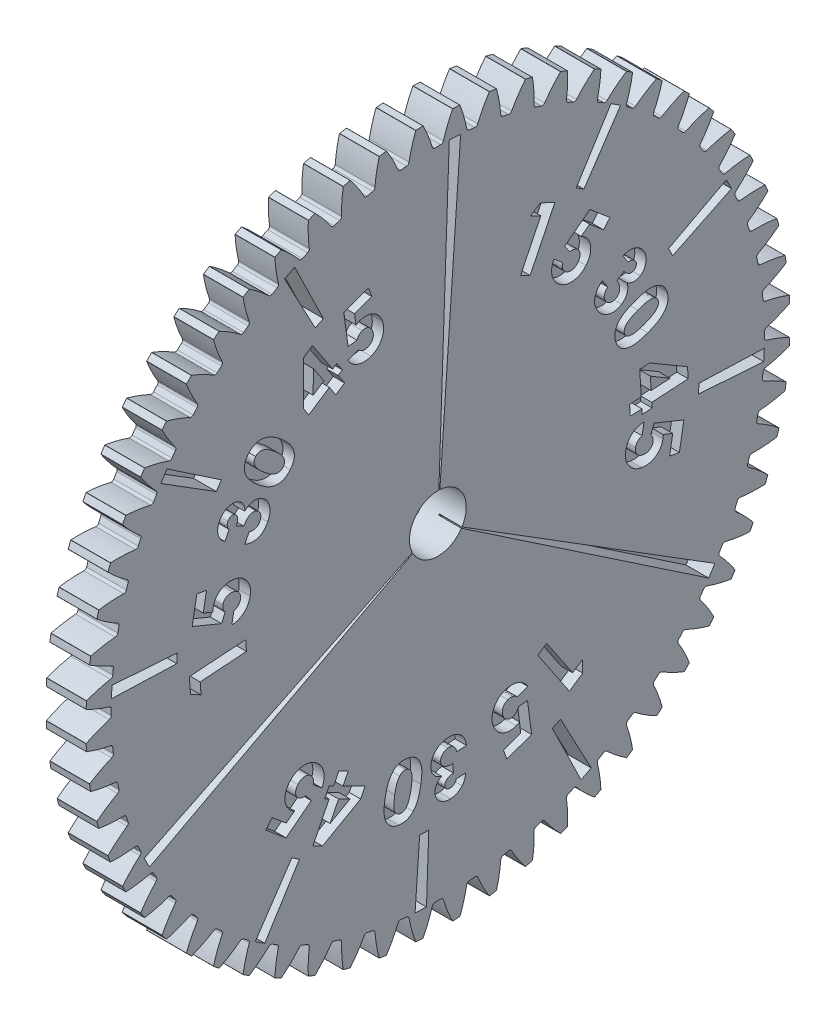
from build123d import *

# Parameters (mm, degrees)
BASPROSKE_W                = 4.445
BASPROSKE_H                = 39.37
TOOTHCUT_DEPTH             = 56.854738608
BREAKS_R                   = 0.0254
ROOTFILLETS_R              = 0.3048
TEETHCUTS_COUNT            = 60
TEETHCUTS_ANGLE            = 354
BREAKS_OF_TEETHCUTS_R      = 0.0254
ROOTFILLETS_OF_TEETHCUTS_R = 0.3048
BORSKE_R                   = 3.175
BORE_DEPTH                 = 50.8000508
TEXT_2_DEPTH               = 1.27
CIRPATTERN1_COUNT          = 3
CUT_EXTRUDE2_START         = -2.54
CUT_EXTRUDE2_DEPTH         = 2.54
CIRPATTERN2_COUNT          = 3


with BuildPart() as part:
    # BasProSke → Base-Revolve (revolve)
    with BuildSketch(Plane(origin=(0, 0, 0), x_dir=(1, 0, 0), z_dir=(0, 1, 0)), mode=Mode.PRIVATE) as base_revolve_sk:
        with Locations((2.2225, 19.685)):
            Rectangle(BASPROSKE_W, BASPROSKE_H)
    revolve(base_revolve_sk.sketch.rotate(Axis((-10, 0, 0), (1, 0, 0)), 180), axis=Axis((-10, 0, 0), (1, 0, 0)))

    # TooCutSke → ToothCut (cut, through all)
    with BuildSketch(Plane(origin=(0, 0, 0), x_dir=(0, 0, -1), z_dir=(1, 0, 0))):
        with BuildLine():
            ThreePointArc((0.554451235, 36.520991483), (0, 36.5252), (-0.554451235, 36.520991483))
            ThreePointArc((-0.554451235, 36.520991483), (-1.040157024, 37.968457667), (-1.668254373, 39.360061846))
            ThreePointArc((-1.668254373, 39.360061846), (0, 39.3954), (1.668254373, 39.360061846))
            ThreePointArc((1.668254373, 39.360061846), (1.040157024, 37.968457667), (0.554451235, 36.520991483))
        make_face()
    toothcut = extrude(amount=TOOTHCUT_DEPTH, mode=Mode.SUBTRACT)

    # Breaks
    breaks_edges = [part.edges().sort_by_distance(p)[0] for p in [
        (2.2225, 39.335177282, -1.655514489),
        (2.2225, 39.335177282, 1.655514489),
    ]]
    fillet(breaks_edges, radius=BREAKS_R)

    # RootFillets
    rootfillets_edges = [part.edges().sort_by_distance(p)[0] for p in [
        (2.2225, 36.520991483, -0.554451235),
        (2.2225, 36.520991483, 0.554451235),
    ]]
    fillet(rootfillets_edges, radius=ROOTFILLETS_R)

    # TeethCuts: ToothCut ×60 about axis
    teethcuts_axis = Axis((-10, 0, 0), (1, 0, 0))
    for i in range(1, TEETHCUTS_COUNT):
        add(toothcut.rotate(teethcuts_axis, i * TEETHCUTS_ANGLE / (TEETHCUTS_COUNT - 1)), mode=Mode.SUBTRACT)

    # Breaks of TeethCuts
    breaks_of_teethcuts_edges = [part.edges().sort_by_distance(p)[0] for p in [
        (2.2225, 39.29274345, 2.465200226),
        (2.2225, 38.946646679, 5.758091041),
        (2.2225, 38.819810099, 6.558905692),
        (2.2225, 38.131408466, 9.797580742),
        (2.2225, 37.921558785, 10.580750414),
        (2.2225, 36.898394562, 13.729726099),
        (2.2225, 36.607830937, 14.486670221),
        (2.2225, 35.261114125, 17.511445704),
        (2.2225, 34.893020033, 18.233871037),
        (2.2225, 33.237505544, 21.101306244),
        (2.2225, 32.795913899, 21.781297747),
        (2.2225, 30.849739896, 24.459976458),
        (2.2225, 30.33948887, 25.090084),
        (2.2225, 28.123978042, 27.550658052),
        (2.2225, 27.550658052, 28.123978042),
        (2.2225, 25.090084, 30.33948887),
        (2.2225, 24.459976458, 30.849739896),
        (2.2225, 21.781297747, 32.795913899),
        (2.2225, 21.101306244, 33.237505544),
        (2.2225, 18.233871037, 34.893020033),
        (2.2225, 17.511445704, 35.261114125),
        (2.2225, 14.486670221, 36.607830937),
        (2.2225, 13.729726099, 36.898394562),
        (2.2225, 10.580750414, 37.921558785),
        (2.2225, 9.797580742, 38.131408466),
        (2.2225, 6.558905692, 38.819810099),
        (2.2225, 5.758091041, 38.946646679),
        (2.2225, 2.465200226, 39.29274345),
        (2.2225, 1.655514489, 39.335177282),
        (2.2225, -1.655514489, 39.335177282),
        (2.2225, -2.465200226, 39.29274345),
        (2.2225, -5.758091041, 38.946646679),
        (2.2225, -6.558905692, 38.819810099),
        (2.2225, -9.797580742, 38.131408466),
        (2.2225, -10.580750414, 37.921558785),
        (2.2225, -13.729726099, 36.898394562),
        (2.2225, -14.486670221, 36.607830937),
        (2.2225, -17.511445704, 35.261114125),
        (2.2225, -18.233871037, 34.893020033),
        (2.2225, -21.101306244, 33.237505544),
        (2.2225, -21.781297747, 32.795913899),
        (2.2225, -24.459976458, 30.849739896),
        (2.2225, -25.090084, 30.33948887),
        (2.2225, -27.550658052, 28.123978042),
        (2.2225, -28.123978042, 27.550658052),
        (2.2225, -30.33948887, 25.090084),
        (2.2225, -30.849739896, 24.459976458),
        (2.2225, -32.795913899, 21.781297747),
        (2.2225, -33.237505544, 21.101306244),
        (2.2225, -34.893020033, 18.233871037),
        (2.2225, -35.261114125, 17.511445704),
        (2.2225, -36.607830937, 14.486670221),
        (2.2225, -36.898394562, 13.729726099),
        (2.2225, -37.921558785, 10.580750414),
        (2.2225, -38.131408466, 9.797580742),
        (2.2225, -38.819810099, 6.558905692),
        (2.2225, -38.946646679, 5.758091041),
        (2.2225, -39.29274345, 2.465200226),
        (2.2225, -39.335177282, 1.655514489),
        (2.2225, -39.335177282, -1.655514489),
        (2.2225, -39.29274345, -2.465200226),
        (2.2225, -38.946646679, -5.758091041),
        (2.2225, -38.819810099, -6.558905692),
        (2.2225, -38.131408466, -9.797580742),
        (2.2225, -37.921558785, -10.580750414),
        (2.2225, -36.898394562, -13.729726099),
        (2.2225, -36.607830937, -14.486670221),
        (2.2225, -35.261114125, -17.511445704),
        (2.2225, -34.893020033, -18.233871037),
        (2.2225, -33.237505544, -21.101306244),
        (2.2225, -32.795913899, -21.781297747),
        (2.2225, -30.849739896, -24.459976458),
        (2.2225, -30.33948887, -25.090084),
        (2.2225, -28.123978042, -27.550658052),
        (2.2225, -27.550658052, -28.123978042),
        (2.2225, -25.090084, -30.33948887),
        (2.2225, -24.459976458, -30.849739896),
        (2.2225, -21.781297747, -32.795913899),
        (2.2225, -21.101306244, -33.237505544),
        (2.2225, -18.233871037, -34.893020033),
        (2.2225, -17.511445704, -35.261114125),
        (2.2225, -14.486670221, -36.607830937),
        (2.2225, -13.729726099, -36.898394562),
        (2.2225, -10.580750414, -37.921558785),
        (2.2225, -9.797580742, -38.131408466),
        (2.2225, -6.558905692, -38.819810099),
        (2.2225, -5.758091041, -38.946646679),
        (2.2225, -2.465200226, -39.29274345),
        (2.2225, -1.655514489, -39.335177282),
        (2.2225, 1.655514489, -39.335177282),
        (2.2225, 2.465200226, -39.29274345),
        (2.2225, 5.758091041, -38.946646679),
        (2.2225, 6.558905692, -38.819810099),
        (2.2225, 9.797580742, -38.131408466),
        (2.2225, 10.580750414, -37.921558785),
        (2.2225, 13.729726099, -36.898394562),
        (2.2225, 14.486670221, -36.607830937),
        (2.2225, 17.511445704, -35.261114125),
        (2.2225, 18.233871037, -34.893020033),
        (2.2225, 21.101306244, -33.237505544),
        (2.2225, 21.781297747, -32.795913899),
        (2.2225, 24.459976458, -30.849739896),
        (2.2225, 25.090084, -30.33948887),
        (2.2225, 27.550658052, -28.123978042),
        (2.2225, 28.123978042, -27.550658052),
        (2.2225, 30.33948887, -25.090084),
        (2.2225, 30.849739896, -24.459976458),
        (2.2225, 32.795913899, -21.781297747),
        (2.2225, 33.237505544, -21.101306244),
        (2.2225, 34.893020033, -18.233871037),
        (2.2225, 35.261114125, -17.511445704),
        (2.2225, 36.607830937, -14.486670221),
        (2.2225, 36.898394562, -13.729726099),
        (2.2225, 37.921558785, -10.580750414),
        (2.2225, 38.131408466, -9.797580742),
        (2.2225, 38.819810099, -6.558905692),
        (2.2225, 38.946646679, -5.758091041),
        (2.2225, 39.29274345, -2.465200226),
    ]]
    fillet(breaks_of_teethcuts_edges, radius=BREAKS_OF_TEETHCUTS_R)

    # RootFillets of TeethCuts
    rootfillets_of_teethcuts_edges = [part.edges().sort_by_distance(p)[0] for p in [
        (2.2225, 36.378881605, 3.266069224),
        (2.2225, 36.262969734, 4.36889701),
        (2.2225, 35.838197089, 7.050805945),
        (2.2225, 35.607643301, 8.135476234),
        (2.2225, 34.904861785, 10.75829256),
        (2.2225, 34.562192077, 11.812921479),
        (2.2225, 33.589101511, 14.34790907),
        (2.2225, 33.138070244, 15.360941884),
        (2.2225, 31.905332013, 17.780326887),
        (2.2225, 31.350880778, 18.740664596),
        (2.2225, 29.87200102, 21.017939721),
        (2.2225, 29.220204502, 21.915060664),
        (2.2225, 27.511386132, 24.025275609),
        (2.2225, 26.769385551, 24.849350742),
        (2.2225, 24.849350742, 26.769385551),
        (2.2225, 24.025275609, 27.511386132),
        (2.2225, 21.915060664, 29.220204502),
        (2.2225, 21.017939721, 29.87200102),
        (2.2225, 18.740664596, 31.350880778),
        (2.2225, 17.780326887, 31.905332013),
        (2.2225, 15.360941884, 33.138070244),
        (2.2225, 14.34790907, 33.589101511),
        (2.2225, 11.812921479, 34.562192077),
        (2.2225, 10.75829256, 34.904861785),
        (2.2225, 8.135476234, 35.607643301),
        (2.2225, 7.050805945, 35.838197089),
        (2.2225, 4.36889701, 36.262969734),
        (2.2225, 3.266069224, 36.378881605),
        (2.2225, 0.554451235, 36.520991483),
        (2.2225, -0.554451235, 36.520991483),
        (2.2225, -3.266069224, 36.378881605),
        (2.2225, -4.36889701, 36.262969734),
        (2.2225, -7.050805945, 35.838197089),
        (2.2225, -8.135476234, 35.607643301),
        (2.2225, -10.75829256, 34.904861785),
        (2.2225, -11.812921479, 34.562192077),
        (2.2225, -14.34790907, 33.589101511),
        (2.2225, -15.360941884, 33.138070244),
        (2.2225, -17.780326887, 31.905332013),
        (2.2225, -18.740664596, 31.350880778),
        (2.2225, -21.017939721, 29.87200102),
        (2.2225, -21.915060664, 29.220204502),
        (2.2225, -24.025275609, 27.511386132),
        (2.2225, -24.849350742, 26.769385551),
        (2.2225, -26.769385551, 24.849350742),
        (2.2225, -27.511386132, 24.025275609),
        (2.2225, -29.220204502, 21.915060664),
        (2.2225, -29.87200102, 21.017939721),
        (2.2225, -31.350880778, 18.740664596),
        (2.2225, -31.905332013, 17.780326887),
        (2.2225, -33.138070244, 15.360941884),
        (2.2225, -33.589101511, 14.34790907),
        (2.2225, -34.562192077, 11.812921479),
        (2.2225, -34.904861785, 10.75829256),
        (2.2225, -35.607643301, 8.135476234),
        (2.2225, -35.838197089, 7.050805945),
        (2.2225, -36.262969734, 4.36889701),
        (2.2225, -36.378881605, 3.266069224),
        (2.2225, -36.520991483, 0.554451235),
        (2.2225, -36.520991483, -0.554451235),
        (2.2225, -36.378881605, -3.266069224),
        (2.2225, -36.262969734, -4.36889701),
        (2.2225, -35.838197089, -7.050805945),
        (2.2225, -35.607643301, -8.135476234),
        (2.2225, -34.904861785, -10.75829256),
        (2.2225, -34.562192077, -11.812921479),
        (2.2225, -33.589101511, -14.34790907),
        (2.2225, -33.138070244, -15.360941884),
        (2.2225, -31.905332013, -17.780326887),
        (2.2225, -31.350880778, -18.740664596),
        (2.2225, -29.87200102, -21.017939721),
        (2.2225, -29.220204502, -21.915060664),
        (2.2225, -27.511386132, -24.025275609),
        (2.2225, -26.769385551, -24.849350742),
        (2.2225, -24.849350742, -26.769385551),
        (2.2225, -24.025275609, -27.511386132),
        (2.2225, -21.915060664, -29.220204502),
        (2.2225, -21.017939721, -29.87200102),
        (2.2225, -18.740664596, -31.350880778),
        (2.2225, -17.780326887, -31.905332013),
        (2.2225, -15.360941884, -33.138070244),
        (2.2225, -14.34790907, -33.589101511),
        (2.2225, -11.812921479, -34.562192077),
        (2.2225, -10.75829256, -34.904861785),
        (2.2225, -8.135476234, -35.607643301),
        (2.2225, -7.050805945, -35.838197089),
        (2.2225, -4.36889701, -36.262969734),
        (2.2225, -3.266069224, -36.378881605),
        (2.2225, -0.554451235, -36.520991483),
        (2.2225, 0.554451235, -36.520991483),
        (2.2225, 3.266069224, -36.378881605),
        (2.2225, 4.36889701, -36.262969734),
        (2.2225, 7.050805945, -35.838197089),
        (2.2225, 8.135476234, -35.607643301),
        (2.2225, 10.75829256, -34.904861785),
        (2.2225, 11.812921479, -34.562192077),
        (2.2225, 14.34790907, -33.589101511),
        (2.2225, 15.360941884, -33.138070244),
        (2.2225, 17.780326887, -31.905332013),
        (2.2225, 18.740664596, -31.350880778),
        (2.2225, 21.017939721, -29.87200102),
        (2.2225, 21.915060664, -29.220204502),
        (2.2225, 24.025275609, -27.511386132),
        (2.2225, 24.849350742, -26.769385551),
        (2.2225, 26.769385551, -24.849350742),
        (2.2225, 27.511386132, -24.025275609),
        (2.2225, 29.220204502, -21.915060664),
        (2.2225, 29.87200102, -21.017939721),
        (2.2225, 31.350880778, -18.740664596),
        (2.2225, 31.905332013, -17.780326887),
        (2.2225, 33.138070244, -15.360941884),
        (2.2225, 33.589101511, -14.34790907),
        (2.2225, 34.562192077, -11.812921479),
        (2.2225, 34.904861785, -10.75829256),
        (2.2225, 35.607643301, -8.135476234),
        (2.2225, 35.838197089, -7.050805945),
        (2.2225, 36.262969734, -4.36889701),
        (2.2225, 36.378881605, -3.266069224),
    ]]
    fillet(rootfillets_of_teethcuts_edges, radius=ROOTFILLETS_OF_TEETHCUTS_R)

    # BorSke → Bore (cut, symmetric)
    with BuildSketch(Plane(origin=(0, 0, 0), x_dir=(0, 0, -1), z_dir=(1, 0, 0))):
        with Locations(Location((0, 0, 0), (0, 0, 180))):
            Circle(BORSKE_R)
    extrude(amount=BORE_DEPTH, both=True, mode=Mode.SUBTRACT)

    # Sketch2 → Text 2 (cut)
    # profile 1 of 6: a face of its own
    with BuildSketch(Plane(origin=(4.445, 0, 0), x_dir=(0, 0, -1), z_dir=(1, 0, 0))):
        Polygon((11.463172713, 25.32202846), (13.078657489, 24.533366601), (10.311980806, 18.861361392), (9.239655085, 19.384167883), (11.511510053, 24.042360992), (10.342509652, 24.612232787), align=None)
    # profile 2 of 6: a face of its own
    with BuildSketch(Plane(origin=(4.445, 0, 0), x_dir=(0, 0, -1), z_dir=(1, 0, 0))):
        with BuildLine():
            Line((16.994326089, 21.914349586), (19.240740352, 20.015200949))
            Line((19.240740352, 20.015200949), (18.529672644, 19.174385644))
            Line((18.529672644, 19.174385644), (16.965069278, 20.497302311))
            Line((16.965069278, 20.497302311), (16.032667435, 19.790050708))
            add(Edge.make_bspline(
                [(16.032667435, 19.790050708), (16.065177053, 19.774465623), (16.129248149, 19.74374999), (16.218778465, 19.689429426), (16.30359355, 19.634524209), (16.354827519, 19.592919644), (16.37993306, 19.572532679)],
                knots=[0, 0, 0, 0, 1.052260992, 2.073832889, 3.056144392, 4, 4, 4, 4], degree=3))
            add(Edge.make_bspline(
                [(16.37993306, 19.572532679), (16.432235421, 19.526497291), (16.535062113, 19.435991498), (16.669812959, 19.28473163), (16.786754444, 19.12600808), (16.88522394, 18.959077153), (16.964198474, 18.783547688), (17.026104995, 18.600546318), (17.067799944, 18.408978186), (17.090393993, 18.211235314), (17.09406545, 18.011924263), (17.079637904, 17.813943399), (17.041752339, 17.62022398), (16.985569033, 17.429253458), (16.90931451, 17.241880925), (16.810764607, 17.059429154), (16.695758348, 16.87834814), (16.603746949, 16.765535764), (16.556745961, 16.707909282)],
                knots=[0, 0, 0, 0, 1.039746453, 2.044146476, 3.018084295, 3.980279885, 4.932484949, 5.887633077, 6.860170139, 7.854539952, 8.855200445, 9.833308004, 10.813156242, 11.796925032, 12.802302632, 13.82774001, 14.890372628, 16, 16, 16, 16], degree=3))
            add(Edge.make_bspline(
                [(16.556745961, 16.707909282), (16.506866878, 16.651822104), (16.408684147, 16.541419266), (16.24630516, 16.394793604), (16.07489003, 16.268069585), (15.894450777, 16.160160596), (15.704132457, 16.072435685), (15.504908242, 16.003030866), (15.296258324, 15.955146138), (15.081662412, 15.92604685), (14.865299383, 15.917144186), (14.652725442, 15.928334866), (14.445788148, 15.959902088), (14.246216717, 16.014017164), (14.051797242, 16.086601448), (13.865192471, 16.181990136), (13.682378987, 16.294677092), (13.569923045, 16.385642879), (13.512765592, 16.431877631)],
                knots=[0, 0, 0, 0, 1.057096413, 2.080804361, 3.076275545, 4.056932344, 5.038044106, 6.024418116, 7.024469329, 8.049484239, 9.072075593, 10.071358971, 11.044872464, 12.01594416, 12.980319939, 13.963667059, 14.965002631, 16, 16, 16, 16], degree=3))
            add(Edge.make_bspline(
                [(13.512765592, 16.431877631), (13.463260104, 16.47518531), (13.365872666, 16.560380385), (13.234683087, 16.699867502), (13.118278656, 16.845483377), (13.016226635, 16.997389755), (12.92736784, 17.155574585), (12.855641819, 17.321394665), (12.796156727, 17.492496057), (12.753442018, 17.669338735), (12.725108253, 17.849289123), (12.714089512, 18.030246789), (12.717491971, 18.211154573), (12.738121827, 18.392087515), (12.775165256, 18.573425379), (12.829195436, 18.753953183), (12.897838444, 18.935027926), (12.955484177, 19.052281898), (12.984870961, 19.112055916)],
                knots=[0, 0, 0, 0, 1.062988183, 2.091115503, 3.091132471, 4.074179486, 5.047037717, 6.020185775, 6.991472597, 7.972509485, 8.957634093, 9.933097682, 10.899970974, 11.879641497, 12.873245918, 13.888446092, 14.923566859, 16, 16, 16, 16], degree=3))
            Line((12.984870961, 19.112055916), (13.942713509, 18.303041493))
            add(Edge.make_bspline(
                [(13.942713509, 18.303041493), (13.931522883, 18.251098307), (13.909671616, 18.149671953), (13.901769817, 17.997700988), (13.910549842, 17.851936564), (13.942986937, 17.713932066), (13.994212693, 17.584809359), (14.06235303, 17.465435749), (14.146657333, 17.355588807), (14.214786815, 17.292951611), (14.249274006, 17.261244618)],
                knots=[0, 0, 0, 0, 1.109714882, 2.166873866, 3.171506689, 4.154615387, 5.118006578, 6.067293887, 7.021662827, 8, 8, 8, 8], degree=3))
            add(Edge.make_bspline(
                [(14.249274006, 17.261244618), (14.274712656, 17.240725314), (14.324628007, 17.200462631), (14.405757747, 17.150990006), (14.488687404, 17.109854915), (14.574749032, 17.077759699), (14.663770244, 17.054578235), (14.756012122, 17.04221278), (14.850962671, 17.038505631), (14.948152218, 17.043263444), (15.045244296, 17.058645676), (15.139853282, 17.08278564), (15.231189557, 17.116139704), (15.319234018, 17.159340315), (15.402803499, 17.213404705), (15.48402812, 17.274999357), (15.56201889, 17.346134315), (15.609174048, 17.400252207), (15.633248365, 17.427881237)],
                knots=[0, 0, 0, 0, 1.006070259, 1.974096513, 2.92063712, 3.854926314, 4.799210134, 5.748901234, 6.716486575, 7.723828463, 8.741956986, 9.740106985, 10.727943464, 11.732910342, 12.754971009, 13.789728568, 14.871581032, 16, 16, 16, 16], degree=3))
            add(Edge.make_bspline(
                [(15.633248365, 17.427881237), (15.676065915, 17.482881899), (15.758928065, 17.58932127), (15.845389763, 17.767849421), (15.894252458, 17.952410848), (15.901550287, 18.109002882), (15.891985005, 18.231995008), (15.875419451, 18.320749026), (15.849541044, 18.404909091), (15.81701918, 18.484915971), (15.775611006, 18.560079073), (15.72538683, 18.629808183), (15.668550898, 18.696986394), (15.624027955, 18.73606616), (15.601447483, 18.755886045)],
                knots=[0, 0, 0, 0, 1.689306487, 3.269210124, 4.780487642, 6.296670098, 7.051026907, 7.774155296, 8.484407965, 9.186323429, 9.868544708, 10.562939839, 11.271173573, 12, 12, 12, 12], degree=3))
            add(Edge.make_bspline(
                [(15.601447483, 18.755886045), (15.57564506, 18.776103421), (15.524098725, 18.816492329), (15.43688596, 18.864917593), (15.343299524, 18.904704474), (15.241259579, 18.93200858), (15.133192321, 18.951480527), (15.017751887, 18.959426289), (14.895167636, 18.960452823), (14.811464995, 18.951376041), (14.76826439, 18.946691333)],
                knots=[0, 0, 0, 0, 0.893213257, 1.784401, 2.712669867, 3.66147751, 4.660120291, 5.704561958, 6.81527856, 8, 8, 8, 8], degree=3))
            Line((14.76826439, 18.946691333), (14.164047644, 19.741713368))
            Line((14.164047644, 19.741713368), (16.994326089, 21.914349586))
        make_face()
    # profile 3 of 6: a face of its own
    with BuildSketch(Plane(origin=(4.445, 0, 0), x_dir=(0, 0, -1), z_dir=(1, 0, 0))):
        with BuildLine():
            Line((21.277803729, 14.66424021), (20.698285666, 15.545760643))
            add(Edge.make_bspline(
                [(20.698285666, 15.545760643), (20.746206209, 15.567785489), (20.840063472, 15.610923392), (20.983091161, 15.663526881), (21.124499675, 15.704572279), (21.264723573, 15.734330713), (21.403712722, 15.750452818), (21.540943192, 15.755067628), (21.676572145, 15.749154856), (21.765314698, 15.734029232), (21.809514466, 15.726495652)],
                knots=[0, 0, 0, 0, 1.104501895, 2.163279423, 3.188882884, 4.186934479, 5.162547534, 6.115750253, 7.061516736, 8, 8, 8, 8], degree=3))
            add(Edge.make_bspline(
                [(21.809514466, 15.726495652), (21.870157612, 15.713545983), (21.989780474, 15.688001851), (22.160881894, 15.625122768), (22.323696947, 15.550220967), (22.476644985, 15.457114769), (22.619373934, 15.346812625), (22.752210611, 15.220014664), (22.877636075, 15.078468662), (22.950185238, 14.973279408), (22.987207107, 14.919601288)],
                knots=[0, 0, 0, 0, 1.012219785, 1.99667455, 2.97136752, 3.93764159, 4.915929319, 5.913413002, 6.935213775, 8, 8, 8, 8], degree=3))
            add(Edge.make_bspline(
                [(22.987207107, 14.919601288), (23.018020628, 14.870357031), (23.078724473, 14.773343913), (23.153132622, 14.621399078), (23.212116024, 14.46813366), (23.254302553, 14.312964684), (23.281226026, 14.156007707), (23.29318354, 13.997066191), (23.288310494, 13.836099371), (23.267253103, 13.675710754), (23.23218363, 13.519484596), (23.186683146, 13.370342805), (23.124581021, 13.232065859), (23.052982721, 13.101989399), (22.967370137, 12.982105717), (22.867881943, 12.873694391), (22.758744007, 12.771428464), (22.675900018, 12.714397327), (22.633899315, 12.685483366)],
                knots=[0, 0, 0, 0, 1.107732714, 2.182276907, 3.222098425, 4.236731281, 5.244975467, 6.25624231, 7.272635154, 8.312033487, 9.337583208, 10.324994568, 11.281254606, 12.224107316, 13.15427612, 14.083616847, 15.028421484, 16, 16, 16, 16], degree=3))
            add(Edge.make_bspline(
                [(22.633899315, 12.685483366), (22.580001733, 12.652975741), (22.473334621, 12.588640861), (22.298181922, 12.524201071), (22.117049474, 12.483607491), (21.929491339, 12.470828407), (21.738381444, 12.486798373), (21.545567193, 12.52897812), (21.352568195, 12.600799328), (21.229983152, 12.668306251), (21.167030658, 12.70297385)],
                knots=[0, 0, 0, 0, 0.97285042, 1.925339533, 2.874628017, 3.839982423, 4.824236715, 5.8348984, 6.888130714, 8, 8, 8, 8], degree=3))
            add(Edge.make_bspline(
                [(21.167030658, 12.70297385), (21.178868137, 12.659581605), (21.202163808, 12.574187452), (21.226865944, 12.445640798), (21.240642801, 12.319295545), (21.245827454, 12.194959598), (21.239949732, 12.072048262), (21.223470785, 11.951216877), (21.197812751, 11.832155443), (21.161594791, 11.716004745), (21.11624184, 11.603384468), (21.062772695, 11.495296263), (20.99897788, 11.393700131), (20.927785348, 11.296205558), (20.847197566, 11.204364657), (20.758220043, 11.117458225), (20.659836244, 11.036948129), (20.58940975, 10.98804937), (20.553697659, 10.963253631)],
                knots=[0, 0, 0, 0, 1.085783287, 2.136776832, 3.156593573, 4.152110908, 5.138651828, 6.123494972, 7.093605523, 8.076165464, 9.057334978, 10.02266719, 10.983655672, 11.950355534, 12.934751409, 13.930268743, 14.95047406, 16, 16, 16, 16], degree=3))
            add(Edge.make_bspline(
                [(20.553697659, 10.963253631), (20.499524982, 10.929850016), (20.392766115, 10.864021036), (20.223593056, 10.786176058), (20.051634305, 10.72567719), (19.875474265, 10.686141443), (19.695735615, 10.665077641), (19.512387441, 10.662478665), (19.325412769, 10.681031445), (19.137031579, 10.71638697), (18.951435509, 10.771493135), (18.771796412, 10.841981163), (18.601864669, 10.932894971), (18.44070149, 11.040881423), (18.2865922, 11.164642308), (18.143787211, 11.307993042), (18.007915587, 11.46728946), (17.927904461, 11.584346291), (17.886981747, 11.644216505)],
                knots=[0, 0, 0, 0, 0.992976801, 1.956873524, 2.901178572, 3.834616776, 4.769572912, 5.722478348, 6.691728983, 7.698702438, 8.710765565, 9.71039679, 10.706780293, 11.713351317, 12.736058125, 13.787462115, 14.86836917, 16, 16, 16, 16], degree=3))
            add(Edge.make_bspline(
                [(17.886981747, 11.644216505), (17.850586232, 11.70231984), (17.779384946, 11.815988576), (17.69203118, 11.992993059), (17.621947285, 12.170210024), (17.572097898, 12.34846343), (17.539674372, 12.527668961), (17.527537794, 12.707434776), (17.531261942, 12.888032856), (17.556796092, 13.067568033), (17.597954242, 13.244861467), (17.659089142, 13.416697971), (17.737920268, 13.582169842), (17.834072051, 13.741736557), (17.948825663, 13.894592169), (18.081756511, 14.040638947), (18.231225723, 14.181392803), (18.34138757, 14.267111684), (18.397703902, 14.310932417)],
                knots=[0, 0, 0, 0, 1.083966736, 2.120586185, 3.117346372, 4.094495742, 5.04368067, 5.992945248, 6.940116803, 7.895731843, 8.856141217, 9.814836857, 10.774655634, 11.751069679, 12.756947196, 13.792983004, 14.871740937, 16, 16, 16, 16], degree=3))
            Line((18.397703902, 14.310932417), (18.994712449, 13.402593241))
            add(Edge.make_bspline(
                [(18.994712449, 13.402593241), (18.943011596, 13.353123954), (18.844853637, 13.259202791), (18.728490257, 13.102319072), (18.6479002, 12.942659497), (18.602965052, 12.780353531), (18.595718278, 12.61790818), (18.618052659, 12.456733199), (18.673873993, 12.297347219), (18.732491188, 12.198722419), (18.762672018, 12.147942467)],
                knots=[0, 0, 0, 0, 1.215706275, 2.308109811, 3.304671691, 4.243023354, 5.15010043, 6.051568661, 6.996791386, 8, 8, 8, 8], degree=3))
            add(Edge.make_bspline(
                [(18.762672018, 12.147942467), (18.780544189, 12.122380518), (18.815647885, 12.072172917), (18.874388897, 12.002956761), (18.937186899, 11.940770045), (19.005026468, 11.88709537), (19.077001393, 11.841208086), (19.152899785, 11.802243651), (19.233779931, 11.772455855), (19.344445034, 11.741212774), (19.485625558, 11.723909411), (19.653240552, 11.736084121), (19.815034428, 11.785198424), (19.91257368, 11.84156428), (19.962519273, 11.870426775)],
                knots=[0, 0, 0, 0, 0.816628101, 1.603983289, 2.374303935, 3.127961515, 3.865071511, 4.607226425, 5.357921314, 6.118696777, 7.616353983, 9.056214768, 10.492616077, 12, 12, 12, 12], degree=3))
            add(Edge.make_bspline(
                [(19.962519273, 11.870426775), (19.988629032, 11.888891286), (20.040359014, 11.925474115), (20.109334434, 11.990093881), (20.169379058, 12.061661852), (20.219562707, 12.140215149), (20.260902416, 12.225562517), (20.293323946, 12.317466496), (20.31667333, 12.416355493), (20.330537187, 12.521016639), (20.334107429, 12.631190954), (20.325659833, 12.745238018), (20.305614591, 12.863211103), (20.272491031, 12.983966372), (20.227968921, 13.108465311), (20.170042378, 13.235407693), (20.101350269, 13.366366238), (20.048175432, 13.45265344), (20.020820889, 13.497041859)],
                knots=[0, 0, 0, 0, 0.844575966, 1.673316897, 2.490254722, 3.308225666, 4.130765416, 4.991927547, 5.879113606, 6.812004279, 7.778301382, 8.78777021, 9.829963668, 10.936563892, 12.093531996, 13.32141298, 14.622063977, 16, 16, 16, 16], degree=3))
            Line((20.020820889, 13.497041859), (20.807892704, 14.013594176))
            add(Edge.make_bspline(
                [(20.807892704, 14.013594176), (20.846930125, 13.964886007), (20.919857024, 13.873892911), (21.030583895, 13.754309821), (21.133258006, 13.65937801), (21.23078506, 13.58773384), (21.326557487, 13.537946195), (21.421266145, 13.502142609), (21.516924909, 13.479564531), (21.613086119, 13.47184164), (21.707121304, 13.475470142), (21.796695011, 13.495278021), (21.881987143, 13.524553957), (21.933174906, 13.555186787), (21.958766603, 13.570501895)],
                knots=[0, 0, 0, 0, 1.641151196, 3.065880514, 4.281487706, 5.31404377, 6.23758999, 7.110900259, 7.971254026, 8.812450948, 9.641387057, 10.435235877, 11.217684706, 12, 12, 12, 12], degree=3))
            add(Edge.make_bspline(
                [(21.958766603, 13.570501895), (21.989317732, 13.593058071), (22.048568867, 13.63680372), (22.119497815, 13.720961631), (22.168955746, 13.81714825), (22.197988753, 13.92311678), (22.206492781, 14.034954081), (22.190677637, 14.148797609), (22.151091244, 14.26237982), (22.10899066, 14.332603805), (22.087030158, 14.369234033)],
                knots=[0, 0, 0, 0, 1.003362766, 1.945930745, 2.885344431, 3.847061843, 4.838093377, 5.835522168, 6.870965263, 8, 8, 8, 8], degree=3))
            add(Edge.make_bspline(
                [(22.087030158, 14.369234033), (22.064306831, 14.400399531), (22.019337977, 14.462075215), (21.934689571, 14.539466391), (21.839214237, 14.603795955), (21.73228236, 14.650509584), (21.619986938, 14.681846975), (21.505598101, 14.696858174), (21.390374537, 14.690792844), (21.315692406, 14.6731772), (21.277803729, 14.66424021)],
                knots=[0, 0, 0, 0, 1.003235961, 1.985377107, 2.971690051, 3.992171979, 5.012301782, 6.002561655, 6.986634455, 8, 8, 8, 8], degree=3))
        make_face()
    # profile 4 of 6: a face of its own
    with BuildSketch(Plane(origin=(4.445, 0, 0), x_dir=(0, 0, -1), z_dir=(1, 0, 0))):
        with BuildLine():
            add(Edge.make_bspline(
                [(25.60070388, 9.701869121), (25.617701208, 9.653105841), (25.651243717, 9.556876431), (25.689204367, 9.411008109), (25.717926076, 9.26706542), (25.73444814, 9.124708539), (25.738417772, 8.983985884), (25.734640579, 8.845169886), (25.718042121, 8.707839782), (25.689802359, 8.572648981), (25.651351363, 8.43915359), (25.601488967, 8.308045156), (25.537225711, 8.180437347), (25.463096904, 8.054508746), (25.375978498, 7.931729201), (25.277700131, 7.811465587), (25.167664937, 7.693251428), (25.044599679, 7.577577614), (24.907363562, 7.463407388), (24.75243102, 7.353016149), (24.581204445, 7.243643936), (24.392319155, 7.13614284), (24.186402031, 7.030586003), (23.962594706, 6.926736073), (23.721955402, 6.824232382), (23.55415091, 6.760188893), (23.46803077, 6.727320677)],
                knots=[0, 0, 0, 0, 0.895016731, 1.766225148, 2.610727443, 3.438255133, 4.247358951, 5.049727752, 5.843790469, 6.642045477, 7.441806601, 8.250264719, 9.069990701, 9.915970456, 10.781609817, 11.677260548, 12.607042514, 13.579531734, 14.603694663, 15.699633941, 16.87545126, 18.125037914, 19.466209318, 20.886192268, 22.401940533, 24, 24, 24, 24], degree=3))
            add(Edge.make_bspline(
                [(23.46803077, 6.727320677), (23.380389893, 6.695645932), (23.209856217, 6.634012469), (22.958127288, 6.553837038), (22.719046196, 6.485845116), (22.492011585, 6.430315681), (22.276820231, 6.388454367), (22.073789711, 6.358249), (21.882890864, 6.343444713), (21.703730674, 6.339042107), (21.534827248, 6.348168967), (21.374695969, 6.363706518), (21.222368272, 6.389480854), (21.078187914, 6.424147989), (20.941949951, 6.46778088), (20.813464152, 6.518236414), (20.69355609, 6.579713572), (20.58110192, 6.649796678), (20.475828801, 6.729491506), (20.377050372, 6.818425904), (20.286326459, 6.918383197), (20.200576229, 7.027225452), (20.1216718, 7.146503827), (20.048108484, 7.274846588), (19.980988964, 7.412993342), (19.94357259, 7.510206646), (19.924458554, 7.559867753)],
                knots=[0, 0, 0, 0, 1.622559066, 3.157213554, 4.599104964, 5.950070167, 7.225627075, 8.415343655, 9.522022752, 10.557718392, 11.533454241, 12.465492352, 13.357835933, 14.221273793, 15.045325756, 15.847149526, 16.62201349, 17.388198227, 18.151627973, 18.918290829, 19.69907313, 20.499238525, 21.328913212, 22.186842853, 23.073754447, 24, 24, 24, 24], degree=3))
            add(Edge.make_bspline(
                [(19.924458554, 7.559867753), (19.906645644, 7.610169946), (19.871768955, 7.708658848), (19.83240498, 7.857699525), (19.802960563, 8.003693366), (19.783941879, 8.147026065), (19.776680681, 8.287430105), (19.781683516, 8.424665851), (19.79647058, 8.559303662), (19.823402701, 8.691615209), (19.862396151, 8.821246964), (19.911202299, 8.94905573), (19.972487122, 9.073811603), (20.043686788, 9.19687772), (20.126910975, 9.317206171), (20.222085959, 9.435210177), (20.327827132, 9.55141323), (20.445817779, 9.665962282), (20.578448049, 9.778380317), (20.728144687, 9.889362721), (20.896623247, 9.997626306), (21.083658615, 10.103128806), (21.287980581, 10.207911611), (21.509803503, 10.311955768), (21.750151464, 10.412953329), (21.917410007, 10.476977653), (22.003494178, 10.509929518)],
                knots=[0, 0, 0, 0, 0.935457845, 1.831574548, 2.70044807, 3.54587997, 4.364822295, 5.162760759, 5.951593682, 6.737594584, 7.526898522, 8.323088397, 9.133963813, 9.961652454, 10.814334368, 11.696789836, 12.618363074, 13.567942859, 14.578575022, 15.665059852, 16.833463026, 18.088070847, 19.429369825, 20.859448176, 22.383629361, 24, 24, 24, 24], degree=3))
            add(Edge.make_bspline(
                [(22.003494178, 10.509929518), (22.123985675, 10.553437958), (22.356333143, 10.637336623), (22.6987739, 10.740289562), (23.021047351, 10.819117227), (23.323134573, 10.874534729), (23.604807437, 10.90746626), (23.86618633, 10.914978778), (24.108153992, 10.899816923), (24.260021949, 10.868053783), (24.33322675, 10.85274302)],
                knots=[0, 0, 0, 0, 1.287881798, 2.483462174, 3.593402583, 4.622111192, 5.569836948, 6.441641431, 7.248825552, 8, 8, 8, 8], degree=3))
            add(Edge.make_bspline(
                [(24.33322675, 10.85274302), (24.40809871, 10.831228309), (24.55462397, 10.78912378), (24.760167321, 10.696335903), (24.9487454, 10.584647447), (25.117249779, 10.449093327), (25.268653043, 10.29393719), (25.398886385, 10.116257297), (25.512828069, 9.918592587), (25.570910243, 9.775347593), (25.60070388, 9.701869121)],
                knots=[0, 0, 0, 0, 1.045559785, 2.04617217, 3.020643427, 3.983074933, 4.943336034, 5.925182519, 6.935708577, 8, 8, 8, 8], degree=3))
        make_face()
        with BuildLine():
            add(Edge.make_bspline(
                [(24.630564991, 9.312414327), (24.613103149, 9.354452994), (24.578797341, 9.437042815), (24.500036333, 9.546082844), (24.404964995, 9.640263682), (24.290479592, 9.71920699), (24.153233524, 9.778790968), (23.99008194, 9.811787039), (23.802717082, 9.823952002), (23.630298073, 9.812844087), (23.478504349, 9.793224729), (23.350474266, 9.770787132), (23.212035905, 9.740278772), (23.062720983, 9.701661021), (22.903183959, 9.654495716), (22.732693741, 9.601114905), (22.552169005, 9.538942992), (22.428642001, 9.494107359), (22.364964197, 9.470994722)],
                knots=[0, 0, 0, 0, 0.862052471, 1.693601726, 2.534016225, 3.394011779, 4.31971038, 5.355008489, 6.538917171, 7.877097582, 8.628830657, 9.445601956, 10.344783385, 11.320577106, 12.374136769, 13.504138112, 14.713390597, 16, 16, 16, 16], degree=3))
            add(Edge.make_bspline(
                [(22.364964197, 9.470994722), (22.282736957, 9.439676699), (22.125007977, 9.379602202), (21.90166811, 9.28444616), (21.702316726, 9.18711104), (21.523834287, 9.092420449), (21.368600672, 8.995517168), (21.234443868, 8.899583394), (21.124208838, 8.801818535), (21.035795043, 8.703237981), (20.966785744, 8.604739594), (20.912239897, 8.506567718), (20.870686182, 8.409120517), (20.844888571, 8.310448546), (20.831648731, 8.212125867), (20.832480401, 8.113438448), (20.849477183, 8.015010236), (20.870090373, 7.951435072), (20.880605055, 7.919005707)],
                knots=[0, 0, 0, 0, 1.769394187, 3.394066772, 4.879772604, 6.229701565, 7.455085317, 8.55728846, 9.542633026, 10.411785374, 11.214123329, 11.955844553, 12.667123967, 13.338276084, 14.000447334, 14.657059471, 15.314972936, 16, 16, 16, 16], degree=3))
            add(Edge.make_bspline(
                [(20.880605055, 7.919005707), (20.892950929, 7.888652247), (20.917019683, 7.829477013), (20.967462707, 7.748828202), (21.027066082, 7.67695327), (21.097787054, 7.614854423), (21.1782019, 7.562331162), (21.267317131, 7.517167691), (21.367378278, 7.483944868), (21.437807507, 7.468643326), (21.474115505, 7.460755006)],
                knots=[0, 0, 0, 0, 0.996780817, 1.943262465, 2.884841955, 3.832878065, 4.798501752, 5.804734258, 6.868286562, 8, 8, 8, 8], degree=3))
            add(Edge.make_bspline(
                [(21.474115505, 7.460755006), (21.522219859, 7.453846159), (21.623477833, 7.439303281), (21.785353174, 7.438980525), (21.962618725, 7.452151984), (22.155527558, 7.480500955), (22.363499964, 7.525933238), (22.5871622, 7.585622322), (22.826718244, 7.66056251), (22.990171912, 7.719378875), (23.075077878, 7.74993102)],
                knots=[0, 0, 0, 0, 0.708865272, 1.492136498, 2.357035395, 3.303311101, 4.336274874, 5.463715124, 6.682527455, 8, 8, 8, 8], degree=3))
            add(Edge.make_bspline(
                [(23.075077878, 7.74993102), (23.160444979, 7.782352462), (23.324447752, 7.844638826), (23.556051686, 7.943886882), (23.765178426, 8.041438731), (23.949896641, 8.140189276), (24.112427616, 8.237672466), (24.250134129, 8.336346892), (24.364899407, 8.434688372), (24.457635702, 8.533074668), (24.528865555, 8.633433872), (24.588590395, 8.730271385), (24.630418158, 8.828878149), (24.66111867, 8.925926976), (24.674248297, 9.023929741), (24.676809428, 9.121368213), (24.660595125, 9.218354245), (24.640670283, 9.280762633), (24.630564991, 9.312414327)],
                knots=[0, 0, 0, 0, 1.796335037, 3.451024164, 4.956080272, 6.33473225, 7.570091115, 8.682124438, 9.663315876, 10.539853506, 11.333673117, 12.081172698, 12.772975353, 13.435815001, 14.07708835, 14.711808803, 15.346667425, 16, 16, 16, 16], degree=3))
        make_face(mode=Mode.SUBTRACT)
    # profile 5 of 6: a face of its own
    with BuildSketch(Plane(origin=(4.445, 0, 0), x_dir=(0, 0, -1), z_dir=(1, 0, 0))):
        Polygon((27.917005904, 1.221398592), (27.990783949, 0.019325275), (23.924087234, -0.2287216), (23.958432186, -0.790961184), (22.846673372, -0.859651088), (22.81232842, -0.297411504), (21.516124494, -0.37627769), (21.443618484, 0.799082887), (22.739822411, 0.877949073), (22.571913757, 3.634449473), (23.683672571, 3.703139377), align=None)
        Polygon((23.851581225, 0.946638976), (25.968247891, 1.076386573), (23.763810792, 2.389126957), align=None, mode=Mode.SUBTRACT)
    # profile 6 of 6: a face of its own
    with BuildSketch(Plane(origin=(4.445, 0, 0), x_dir=(0, 0, -1), z_dir=(1, 0, 0))):
        with BuildLine():
            Line((27.505196431, -3.724180401), (27.00401454, -6.626964856))
            Line((27.00401454, -6.626964856), (25.916424395, -6.439975674))
            Line((25.916424395, -6.439975674), (26.266234091, -4.417439616))
            Line((26.266234091, -4.417439616), (25.179915982, -3.969683206))
            add(Edge.make_bspline(
                [(25.179915982, -3.969683206), (25.183613667, -4.006117012), (25.190868285, -4.077597772), (25.189150819, -4.183007922), (25.185808056, -4.283881009), (25.175870266, -4.348808096), (25.171011735, -4.380550594)],
                knots=[0, 0, 0, 0, 1.065077464, 2.089612788, 3.066022121, 4, 4, 4, 4], degree=3))
            add(Edge.make_bspline(
                [(25.171011735, -4.380550594), (25.157480237, -4.449134611), (25.130857576, -4.584070815), (25.069095366, -4.777884249), (24.99160838, -4.959643715), (24.896673015, -5.128780164), (24.785436789, -5.286116909), (24.657841516, -5.431373375), (24.513925851, -5.564927567), (24.354956297, -5.684756408), (24.183590964, -5.788117127), (24.005108733, -5.876286152), (23.818062015, -5.941538231), (23.625082701, -5.991153289), (23.424067056, -6.018593401), (23.216362931, -6.026609888), (23.00160484, -6.019098821), (22.857875524, -5.997075603), (22.784673594, -5.985859087)],
                knots=[0, 0, 0, 0, 1.041298569, 2.048711659, 3.025465149, 3.981866301, 4.934039921, 5.892443659, 6.858402826, 7.855714134, 8.853986205, 9.837646809, 10.817156756, 11.80124364, 12.803190099, 13.834312114, 14.897006279, 16, 16, 16, 16], degree=3))
            add(Edge.make_bspline(
                [(22.784673594, -5.985859087), (22.711019931, -5.971004156), (22.565948668, -5.941745276), (22.356368241, -5.876770366), (22.159551447, -5.792518284), (21.975493687, -5.689874109), (21.802637771, -5.571071617), (21.641253202, -5.434516828), (21.493965665, -5.278398564), (21.359908622, -5.107617581), (21.242001056, -4.925548551), (21.143927257, -4.736019456), (21.066175519, -4.541079251), (21.01249817, -4.340616239), (20.975617756, -4.135994236), (20.962193787, -3.926179846), (20.969439325, -3.711348933), (20.990557425, -3.567999761), (21.001280165, -3.495214055)],
                knots=[0, 0, 0, 0, 1.05587619, 2.079696866, 3.078481034, 4.060472893, 5.037712653, 6.023118324, 7.026658803, 8.049854521, 9.071729627, 10.071545064, 11.045689, 12.016068292, 12.984357945, 13.964194264, 14.966317312, 16, 16, 16, 16], degree=3))
            add(Edge.make_bspline(
                [(21.001280165, -3.495214055), (21.013809812, -3.430523549), (21.038439017, -3.303363095), (21.092707534, -3.119304533), (21.158899392, -2.944482728), (21.237267619, -2.778245709), (21.331302319, -2.623037832), (21.435601556, -2.475365436), (21.554225536, -2.338005955), (21.685279982, -2.211208861), (21.826040833, -2.095178973), (21.976625019, -1.993448574), (22.135178614, -1.904906045), (22.302256793, -1.831276911), (22.477547328, -1.77117415), (22.660894248, -1.725324427), (22.852949796, -1.694855605), (22.983863521, -1.685025531), (23.050528963, -1.680019744)],
                knots=[0, 0, 0, 0, 1.062344157, 2.088222427, 3.090414431, 4.075447529, 5.047791576, 6.013764907, 6.988511231, 7.970333845, 8.951989704, 9.926999917, 10.897514256, 11.877333928, 12.867907215, 13.883060286, 14.921986817, 16, 16, 16, 16], degree=3))
            Line((23.050528963, -1.680019744), (22.835555004, -2.918982084))
            add(Edge.make_bspline(
                [(22.835555004, -2.918982084), (22.785429309, -2.935488677), (22.687334364, -2.967791735), (22.552186307, -3.03709554), (22.432139958, -3.120377983), (22.328928861, -3.217617914), (22.241199669, -3.325745707), (22.174096176, -3.445924425), (22.121389011, -3.573864458), (22.102324268, -3.664412837), (22.092686415, -3.710188013)],
                knots=[0, 0, 0, 0, 1.103115583, 2.158774273, 3.165639563, 4.151282014, 5.117233838, 6.067114456, 7.022862927, 8, 8, 8, 8], degree=3))
            add(Edge.make_bspline(
                [(22.092686415, -3.710188013), (22.087746023, -3.742338887), (22.077970189, -3.805957643), (22.07568173, -3.901163112), (22.083594232, -3.994015564), (22.100186599, -4.08476646), (22.125659953, -4.173830964), (22.160020593, -4.261046771), (22.204968614, -4.34542567), (22.259557151, -4.426024631), (22.321291237, -4.502251381), (22.390833876, -4.571133), (22.465399602, -4.634006855), (22.547775093, -4.687451831), (22.635933468, -4.733496218), (22.730567432, -4.771553394), (22.83140925, -4.802478448), (22.90155119, -4.816214568), (22.937317825, -4.823218863)],
                knots=[0, 0, 0, 0, 0.999484293, 1.977736203, 2.919778346, 3.860917717, 4.810151126, 5.764118895, 6.738190966, 7.743526446, 8.753585797, 9.749320946, 10.749315397, 11.747437995, 12.762199227, 13.803339472, 14.879883329, 16, 16, 16, 16], degree=3))
            add(Edge.make_bspline(
                [(22.937317825, -4.823218863), (22.97245238, -4.828345789), (23.041642362, -4.838442173), (23.144166359, -4.845356493), (23.243440447, -4.841353724), (23.339087183, -4.828249807), (23.431756194, -4.808588534), (23.521046598, -4.778982019), (23.605759201, -4.739084131), (23.687381593, -4.69232247), (23.762506588, -4.638244821), (23.83078937, -4.579234648), (23.891536519, -4.515320603), (23.942572446, -4.445285653), (23.98891961, -4.372256281), (24.02369261, -4.292592018), (24.052495285, -4.208926078), (24.063756674, -4.150490346), (24.069429203, -4.121055401)],
                knots=[0, 0, 0, 0, 1.145815238, 2.256437688, 3.311008341, 4.346492192, 5.369236741, 6.364604159, 7.374912261, 8.386609741, 9.39682515, 10.357239636, 11.296357128, 12.235175428, 13.15055997, 14.081565499, 15.033656073, 16, 16, 16, 16], degree=3))
            add(Edge.make_bspline(
                [(24.069429203, -4.121055401), (24.073614451, -4.088464402), (24.081962891, -4.02345416), (24.080265421, -3.923816315), (24.06617181, -3.823021827), (24.038789485, -3.720879362), (24.00014175, -3.617571208), (23.950865875, -3.512489263), (23.885843006, -3.408116807), (23.836630613, -3.339736198), (23.811206046, -3.304408767)],
                knots=[0, 0, 0, 0, 0.893977892, 1.783244504, 2.704333242, 3.659467528, 4.656945147, 5.705521284, 6.814604894, 8, 8, 8, 8], degree=3))
            Line((23.811206046, -3.304408767), (24.191544588, -2.379639135))
            Line((24.191544588, -2.379639135), (27.505196431, -3.724180401))
        make_face()
    text_2 = extrude(amount=-TEXT_2_DEPTH, mode=Mode.SUBTRACT)

    # CirPattern1: Text 2 ×3 about axis
    cirpattern1_axis = Axis((4.445, 0, 0), (-1, 0, 0))
    for i in range(1, CIRPATTERN1_COUNT):
        add(text_2.rotate(cirpattern1_axis, i * 360 / CIRPATTERN1_COUNT), mode=Mode.SUBTRACT)

    # Sketch3 → Cut-Extrude2 (cut)
    with BuildSketch(Plane(origin=(4.445, 0, 0), x_dir=(0, 0, -1), z_dir=(1, 0, 0)).offset(CUT_EXTRUDE2_START)):
        with BuildLine():
            ThreePointArc((1.019414299, 29.192206057), (1.274122305, 29.182198552), (1.528733282, 29.16996871))
            Line((1.528733282, 29.16996871), (1.911581269, 36.475143483))
            ThreePointArc((1.911581269, 36.475143483), (1.593206847, 36.490436103), (1.274711097, 36.502949835))
            Line((1.274711097, 36.502949835), (1.019414299, 29.192206057))
        make_face()
        with BuildLine():
            Line((1.911581269, 36.475143483), (1.528733282, 29.16996871))
            ThreePointArc((1.528733282, 29.16996871), (1.78322784, 29.155517462), (2.037586598, 29.138845908))
            Line((2.037586598, 29.138845908), (2.547869155, 36.436226449))
            ThreePointArc((2.547869155, 36.436226449), (2.229810116, 36.457073139), (1.911581269, 36.475143483))
        make_face()
        with BuildLine():
            Line((1.528733282, 29.16996871), (0, 0))
            Line((0, 0), (2.037586598, 29.138845908))
            ThreePointArc((2.037586598, 29.138845908), (1.78322784, 29.155517462), (1.528733282, 29.16996871))
        make_face()
        with BuildLine():
            Line((1.019414299, 29.192206057), (0, 0))
            Line((0, 0), (1.528733282, 29.16996871))
            ThreePointArc((1.528733282, 29.16996871), (1.274122305, 29.182198552), (1.019414299, 29.192206057))
        make_face()
        with BuildLine():
            Line((19.893049682, 30.632610228), (15.908906213, 24.49756729))
            ThreePointArc((15.908906213, 24.49756729), (16.122079341, 24.357804863), (16.33402471, 24.216187494))
            Line((16.33402471, 24.216187494), (20.424632638, 30.280763145))
            ThreePointArc((20.424632638, 30.280763145), (20.159608776, 30.457846428), (19.893049682, 30.632610228))
        make_face()
        with BuildLine():
            ThreePointArc((15.478941708, 24.771484889), (15.69452156, 24.635464132), (15.908906213, 24.49756729))
            Line((15.908906213, 24.49756729), (19.893049682, 30.632610228))
            ThreePointArc((19.893049682, 30.632610228), (19.624975655, 30.805041237), (19.35540711, 30.975126322))
            Line((19.35540711, 30.975126322), (15.478941708, 24.771484889))
        make_face()
        with BuildLine():
            Line((36.502949835, -1.274711097), (29.192206057, -1.019414299))
            ThreePointArc((29.192206057, -1.019414299), (29.16996871, -1.528733282), (29.138845908, -2.037586598))
            Line((29.138845908, -2.037586598), (36.436226449, -2.547869155))
            ThreePointArc((36.436226449, -2.547869155), (36.475143483, -1.911581269), (36.502949835, -1.274711097))
        make_face()
        with BuildLine():
            Line((32.249837419, 17.147542725), (25.790899187, 13.713264349))
            ThreePointArc((25.790899187, 13.713264349), (26.026300572, 13.261062497), (26.253774092, 12.804821198))
            Line((26.253774092, 12.804821198), (32.8286323, 16.011593811))
            ThreePointArc((32.8286323, 16.011593811), (32.544191497, 16.582093801), (32.249837419, 17.147542725))
        make_face()
    cut_extrude2 = extrude(amount=CUT_EXTRUDE2_DEPTH, mode=Mode.SUBTRACT)

    # CirPattern2: Cut-Extrude2 ×3 about axis
    cirpattern2_axis = Axis((0, 0, 0), (1, 0, 0))
    for i in range(1, CIRPATTERN2_COUNT):
        add(cut_extrude2.rotate(cirpattern2_axis, i * 360 / CIRPATTERN2_COUNT), mode=Mode.SUBTRACT)


solid = part.part
